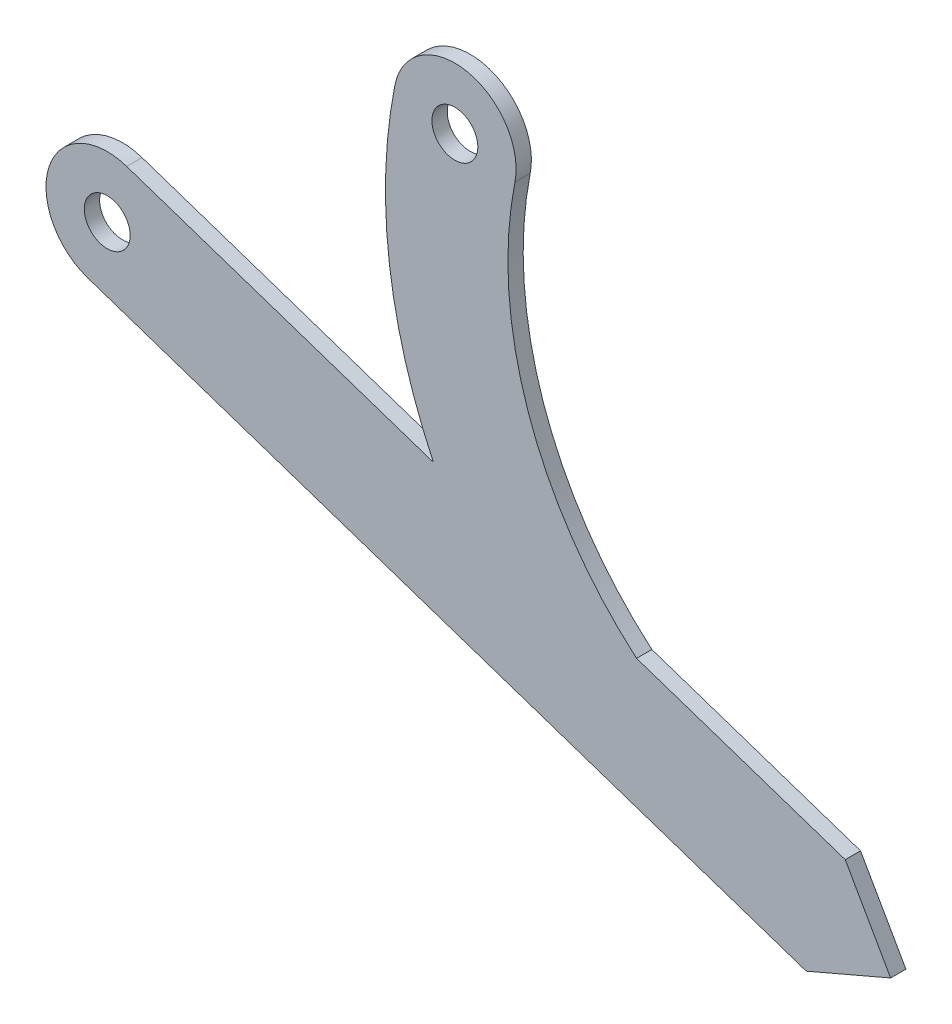
from build123d import *

# Parameters (mm, degrees)
ESQUISSE1_R               = 1.5
T_LE_DE_BASE_PLI_E1_DEPTH = 1


# Sheet-metal steps are written as plain solids
with BuildPart() as part:
    # Esquisse1 → Tôle de base pliée1 (new body)
    with BuildSketch(Plane.XY):
        with BuildLine():
            Line((-53.194732382, -46.443882138), (-33.149125492, -53.169374239))
            ThreePointArc((-33.149125492, -53.169374239), (-36.034099594, -43.334809734), (-35.67163719, -33.092234102))
            ThreePointArc((-35.67163719, -33.092234102), (-30.970075892, -29.94655113), (-27.82439292, -34.648112428))
            ThreePointArc((-27.82439292, -34.648112428), (-26.960351912, -47.211264855), (-19.876250068, -57.622550405))
            Line((-19.876250068, -57.622550405), (-6.239220274, -62.197903832))
            Line((-6.239220274, -62.197903832), (-3.271691792, -67.412668899))
            Line((-3.271691792, -67.412668899), (-8.783892369, -69.782404075))
            Line((-8.783892369, -69.782404075), (-55.739404477, -54.02838238))
            ThreePointArc((-55.739404477, -54.02838238), (-58.259318551, -48.963796212), (-53.194732382, -46.443882138))
        make_face()
        with Locations((-54.467068429, -50.236132259)):
            Circle(ESQUISSE1_R, mode=Mode.SUBTRACT)
        with Locations((-31.748015055, -33.870173265)):
            Circle(ESQUISSE1_R, mode=Mode.SUBTRACT)
    extrude(amount=T_LE_DE_BASE_PLI_E1_DEPTH)


solid = part.part
